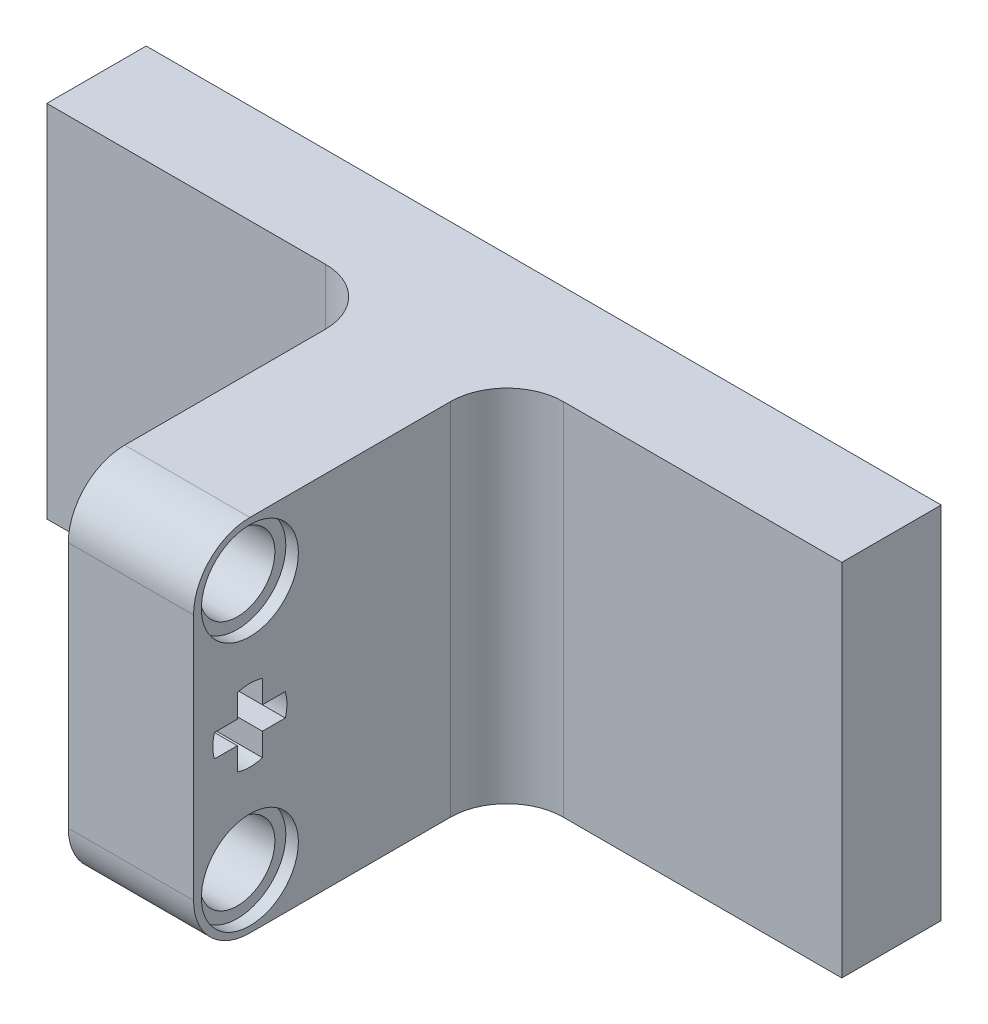
from build123d import *

# Parameters (mm, degrees)
BOSS_EXTRUDE1_DEPTH = 11.5
SKETCH3_R           = 2.4
CUT_EXTRUDE1_DEPTH  = 40.177161665
SKETCH3_3_R         = 3.1
SKETCH3_3_R_2       = 2.4
CUT_EXTRUDE2_DEPTH  = 0.8
FILLET1_R           = 3.6


with BuildPart() as part:
    # Sketch2 → Boss-Extrude1 (new, symmetric)
    with BuildSketch(Plane(origin=(0, 0, 0), x_dir=(1, 0, 0), z_dir=(0, 1, 0))):
        Polygon((-4, -3.175), (-4, -19.599999916), (-4, -23.199999916), (4, -23.199999916), (4, -19.599999916), (4, -3.175), (25.4, -3.175), (25.4, 3.175), (-25.4, 3.175), (-25.4, -3.175), align=None)
    extrude(amount=BOSS_EXTRUDE1_DEPTH, both=True)

    # Sketch3 → Cut-Extrude1 (cut, through all)
    with BuildSketch(Plane(origin=(4, 0, 0), x_dir=(0, 0, -1), z_dir=(1, 0, 0))):
        with BuildLine():
            Line((-20.399999916, 2.19411255), (-20.399999916, 0.73137085))
            Line((-20.399999916, 0.73137085), (-21.862741616, 0.73137085))
            ThreePointArc((-21.862741616, 0.73137085), (-21.967727251, 0), (-21.862741616, -0.73137085))
            Line((-21.862741616, -0.73137085), (-20.399999916, -0.73137085))
            Line((-20.399999916, -0.73137085), (-20.399999916, -2.19411255))
            ThreePointArc((-20.399999916, -2.19411255), (-19.599999916, -2.320249175), (-18.799999916, -2.19411255))
            Line((-18.799999916, -2.19411255), (-18.799999916, -0.73137085))
            Line((-18.799999916, -0.73137085), (-17.337258216, -0.73137085))
            ThreePointArc((-17.337258216, -0.73137085), (-17.232272581, 0), (-17.337258216, 0.73137085))
            Line((-17.337258216, 0.73137085), (-18.799999916, 0.73137085))
            Line((-18.799999916, 0.73137085), (-18.799999916, 2.19411255))
            ThreePointArc((-18.799999916, 2.19411255), (-19.599999916, 2.320249175), (-20.399999916, 2.19411255))
        make_face()
        with Locations((-19.599999916, 8)):
            Circle(SKETCH3_R)
        with Locations((-19.599999916, -8)):
            Circle(SKETCH3_R)
    extrude(amount=-CUT_EXTRUDE1_DEPTH, mode=Mode.SUBTRACT)

    # Sketch3<3> → Cut-Extrude2 (cut)
    # profile 1 of 2: a face of its own
    with BuildSketch(Plane(origin=(4, 0, 0), x_dir=(0, 0, -1), z_dir=(1, 0, 0))):
        with Locations((-19.599999916, 8)):
            Circle(SKETCH3_3_R)
        with Locations((-19.599999916, 8)):
            Circle(SKETCH3_3_R_2, mode=Mode.SUBTRACT)
    # profile 2 of 2: a face of its own
    with BuildSketch(Plane(origin=(4, 0, 0), x_dir=(0, 0, -1), z_dir=(1, 0, 0))):
        with Locations((-19.599999916, -8)):
            Circle(SKETCH3_3_R)
        with Locations((-19.599999916, -8)):
            Circle(SKETCH3_3_R_2, mode=Mode.SUBTRACT)
    cut_extrude2 = extrude(amount=-CUT_EXTRUDE2_DEPTH, mode=Mode.SUBTRACT)

    # Mirror1: Cut-Extrude2 across plane
    add(cut_extrude2.mirror(Plane(origin=(0, 0, 0), x_dir=(0, 0, 1), z_dir=(1, 0, 0))), mode=Mode.SUBTRACT)

    # Fillet1
    fillet1_edges = [part.edges().sort_by_distance(p)[0] for p in [
        (0, -11.5, 23.199999916),
        (0, 11.5, 23.199999916),
        (-4, 0, 3.175),
        (4, 0, 3.175),
    ]]
    fillet(fillet1_edges, radius=FILLET1_R)


solid = part.part
